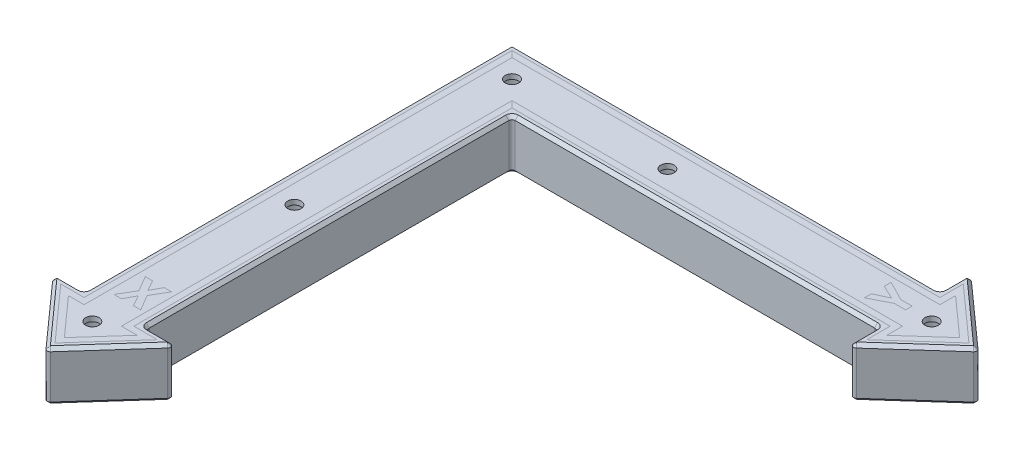
from build123d import *

# Parameters (mm, degrees)
BOSS_EXTRUDE1_DEPTH     = 16
CUT_EXTRUDE1_DEPTH      = 213.734576409
CUT_EXTRUDE1_DEPTH_BACK = 213.734576409
SKETCH2_R               = 2.15
SKETCH3_R               = 5
CUT_EXTRUDE2_DEPTH      = 14.4
CUT_EXTRUDE3_DEPTH      = 1
BOSS_EXTRUDE2_DEPTH     = 1
CUT_EXTRUDE4_DEPTH      = 1
BOSS_EXTRUDE3_DEPTH     = 1
FILLET1_R               = 1
CHAMFER1_SIZE           = 1
CUT_EXTRUDE5_DEPTH      = 1
BOSS_EXTRUDE4_DEPTH     = 1
CUT_EXTRUDE6_DEPTH      = 1
BOSS_EXTRUDE5_DEPTH     = 1
CHAMFER2_SIZE           = 1


with BuildPart() as part:
    # Sketch1 → Boss-Extrude1 (new body)
    with BuildSketch(Plane(origin=(0, 0, 0), x_dir=(1, 0, 0), z_dir=(0, 1, 0))):
        Polygon((0, -150), (20, -127.639320225), (10, -127.639320225), (10, -10), (127.639320225, -10), (127.639320225, -20), (150, 0), (127.639320225, 20), (127.639320225, 10), (-10, 10), (-10, -127.639320225), (-20, -127.639320225), align=None)
    extrude(amount=BOSS_EXTRUDE1_DEPTH)

    # Sketch2 → Cut-Extrude1 (cut, two sides: drawn at the far end of the back side and taken through both)
    with BuildSketch(Plane(origin=(0, 16, 0), x_dir=(1, 0, 0), z_dir=(0, 1, 0)).offset(-CUT_EXTRUDE1_DEPTH_BACK)):
        with Locations(Location((0, 0, 0), (0, 0, 270))):
            Circle(SKETCH2_R)
        with Locations(Location((50, 0, 0), (0, 0, 270))):
            Circle(SKETCH2_R)
        with Locations(Location((135, 0, 0), (0, 0, 270))):
            Circle(SKETCH2_R)
        with Locations(Location((0, -135, 0), (0, 0, 270))):
            Circle(SKETCH2_R)
        with Locations(Location((0, -70, 0), (0, 0, 270))):
            Circle(SKETCH2_R)
    extrude(amount=CUT_EXTRUDE1_DEPTH + CUT_EXTRUDE1_DEPTH_BACK, mode=Mode.SUBTRACT)

    # Sketch3 → Cut-Extrude2 (cut)
    with BuildSketch(Plane.XZ):
        with Locations(Location((135, 0, 0), (0, 0, 270))):
            Circle(SKETCH3_R)
        with Locations(Location((50, 0, 0), (0, 0, 270))):
            Circle(SKETCH3_R)
        with Locations(Location((0, 0, 0), (0, 0, 270))):
            Circle(SKETCH3_R)
        with Locations(Location((0, 70, 0), (0, 0, 270))):
            Circle(SKETCH3_R)
        with Locations(Location((0, 135, 0), (0, 0, 270))):
            Circle(SKETCH3_R)
    extrude(amount=-CUT_EXTRUDE2_DEPTH, mode=Mode.SUBTRACT)

    # Sketch4 → Cut-Extrude3 (cut)
    with BuildSketch(Plane(origin=(0, 16, 0), x_dir=(1, 0, 0), z_dir=(0, 1, 0))):
        Polygon((-6, 6), (-6, -131.639320225), (-11.05572809, -131.639320225), (0, -144), (11.05572809, -131.639320225), (6, -131.639320225), (6, -6), (8, -8), (8, -129.639320225), (15.527864045, -129.639320225), (0, -147), (-15.527864045, -129.639320225), (-8, -129.639320225), (-8, 8), align=None)
    extrude(amount=-CUT_EXTRUDE3_DEPTH, mode=Mode.SUBTRACT)

    # Sketch5 → Cut-Extrude4 (cut)
    with BuildSketch(Plane(origin=(0, 16, 0), x_dir=(1, 0, 0), z_dir=(0, 1, 0))):
        Polygon((131.639320225, 11.05572809), (131.639320225, 6), (-6, 6), (-8, 8), (129.639320225, 8), (129.639320225, 15.527864045), (147, 0), (129.639320225, -15.527864045), (129.639320225, -8), (8, -8), (6, -6), (131.639320225, -6), (131.639320225, -11.05572809), (144, 0), align=None)
    extrude(amount=-CUT_EXTRUDE4_DEPTH, mode=Mode.SUBTRACT)

    # Fillet1
    fillet1_edges = [part.edges().sort_by_distance(p)[0] for p in [
        (150, 8, 0),
        (127.639320225, 8, 20),
        (127.639320225, 8, 10),
        (10, 8, 10),
        (10, 8, 127.639320225),
        (20, 8, 127.639320225),
        (0, 8, 150),
        (-20, 8, 127.639320225),
        (-10, 8, 127.639320225),
        (-10, 8, -10),
        (127.639320225, 8, -10),
        (127.639320225, 8, -20),
    ]]
    fillet(fillet1_edges, radius=FILLET1_R)

    # Chamfer1
    chamfer1_edges = [part.edges().sort_by_distance(p)[0] for p in [
        (127.639320225, 0, 14.381966011),
        (127.639320225, 16, 14.381966011),
        (68.819660113, 0, 10),
        (68.819660113, 16, 10),
        (58.819660113, 0, -10),
        (58.819660113, 16, -10),
        (127.639320225, 0, -14.381966011),
        (127.639320225, 16, -14.381966011),
        (-14.381966011, 0, 127.639320225),
        (-14.381966011, 16, 127.639320225),
        (-10, 0, 58.819660113),
        (-10, 16, 58.819660113),
        (10, 0, 68.819660113),
        (10, 16, 68.819660113),
        (14.381966011, 0, 127.639320225),
        (14.381966011, 16, 127.639320225),
        (139.236326779, 0, -9.627322004),
        (139.236326779, 0, 9.627322004),
        (9.627322004, 0, 139.236326779),
        (-9.627322004, 0, 139.236326779),
        (18.676802952, 0, 128.231071935),
        (-18.676802952, 0, 128.231071935),
        (0, 0, 149.5),
        (128.231071935, 0, 18.676802952),
        (149.5, 0, 0),
        (128.231071935, 0, -18.676802952),
        (-9.707106781, 0, -9.707106781),
        (139.236326779, 16, -9.627322004),
        (-9.627322004, 16, 139.236326779),
        (9.627322004, 16, 139.236326779),
        (139.236326779, 16, 9.627322004),
        (18.676802952, 16, 128.231071935),
        (-18.676802952, 16, 128.231071935),
        (0, 16, 149.5),
        (128.231071935, 16, 18.676802952),
        (149.5, 16, 0),
        (128.231071935, 16, -18.676802952),
        (-9.707106781, 16, -9.707106781),
        (127.346427006, 0, 10.292893219),
        (127.346427006, 16, 10.292893219),
        (127.346427006, 0, -10.292893219),
        (127.346427006, 16, -10.292893219),
        (-10.292893219, 0, 127.346427006),
        (-10.292893219, 16, 127.346427006),
        (10.292893219, 0, 127.346427006),
        (10.292893219, 16, 127.346427006),
        (10.292893219, 0, 10.292893219),
        (10.292893219, 16, 10.292893219),
    ]]
    chamfer(chamfer1_edges, length=CHAMFER1_SIZE - 0.0001)  # a hair under: the kernel refuses the full size

    # Sketch6 → Cut-Extrude5 (cut)
    with BuildSketch(Plane(origin=(0, 16, 0), x_dir=(1, 0, 0), z_dir=(0, 1, 0))):
        Polygon((0.258198052, -117.447646104), (2.12913961, -114), (4.491152597, -114), (1.587337662, -118.959415584), (4.566233766, -124), (2.175811688, -124), (0.258198052, -120.497564935), (-1.659415584, -124), (-4.049837662, -124), (-1.070941558, -118.959415584), (-3.974756494, -114), (-1.610714286, -114), align=None)
    extrude(amount=-CUT_EXTRUDE5_DEPTH, mode=Mode.SUBTRACT)

    # Sketch7 → Cut-Extrude6 (cut)
    with BuildSketch(Plane(origin=(0, 16, 0), x_dir=(1, 0, 0), z_dir=(0, 1, 0))):
        Polygon((122.088079969, 0.081576582), (117.583209839, 2.157469439), (117.583209839, 4.403816842), (123.956992307, 1.128654504), (127.583209839, 1.128654504), (127.583209839, -0.959413678), (123.956992307, -0.959413678), (117.583209839, -4.232546794), (117.583209839, -1.98011173), align=None)
    extrude(amount=-CUT_EXTRUDE6_DEPTH, mode=Mode.SUBTRACT)

    # Chamfer2
    chamfer2_edges = [part.edges().sort_by_distance(p)[0] for p in [
        (135, 0, 5),
        (50, 0, 5),
        (0, 0, 5),
        (0, 0, 75),
        (0, 0, 140),
    ]]
    chamfer(chamfer2_edges, length=CHAMFER2_SIZE)


with BuildPart() as body_2:
    # Sketch4<3> → Boss-Extrude2 (new body)
    with BuildSketch(Plane(origin=(0, 16, 0), x_dir=(1, 0, 0), z_dir=(0, 1, 0))):
        Polygon((-6, 6), (-6, -131.639320225), (-11.05572809, -131.639320225), (0, -144), (11.05572809, -131.639320225), (6, -131.639320225), (6, -6), (8, -8), (8, -129.639320225), (15.527864045, -129.639320225), (0, -147), (-15.527864045, -129.639320225), (-8, -129.639320225), (-8, 8), align=None)
    extrude(amount=-BOSS_EXTRUDE2_DEPTH)


with BuildPart() as body_3:
    # Sketch5<2> → Boss-Extrude3 (new body)
    with BuildSketch(Plane(origin=(0, 16, 0), x_dir=(1, 0, 0), z_dir=(0, 1, 0))):
        Polygon((131.639320225, 11.05572809), (131.639320225, 6), (-6, 6), (-8, 8), (129.639320225, 8), (129.639320225, 15.527864045), (147, 0), (129.639320225, -15.527864045), (129.639320225, -8), (8, -8), (6, -6), (131.639320225, -6), (131.639320225, -11.05572809), (144, 0), align=None)
    extrude(amount=-BOSS_EXTRUDE3_DEPTH)


with BuildPart() as body_4:
    # Sketch6<2> → Boss-Extrude4 (new body)
    with BuildSketch(Plane(origin=(0, 16, 0), x_dir=(1, 0, 0), z_dir=(0, 1, 0))):
        Polygon((0.258198052, -117.447646104), (2.12913961, -114), (4.491152597, -114), (1.587337662, -118.959415584), (4.566233766, -124), (2.175811688, -124), (0.258198052, -120.497564935), (-1.659415584, -124), (-4.049837662, -124), (-1.070941558, -118.959415584), (-3.974756494, -114), (-1.610714286, -114), align=None)
    extrude(amount=-BOSS_EXTRUDE4_DEPTH)


with BuildPart() as body_5:
    # Sketch7<2> → Boss-Extrude5 (new body)
    with BuildSketch(Plane(origin=(0, 16, 0), x_dir=(1, 0, 0), z_dir=(0, 1, 0))):
        Polygon((122.088079969, 0.081576582), (117.583209839, 2.157469439), (117.583209839, 4.403816842), (123.956992307, 1.128654504), (127.583209839, 1.128654504), (127.583209839, -0.959413678), (123.956992307, -0.959413678), (117.583209839, -4.232546794), (117.583209839, -1.98011173), align=None)
    extrude(amount=-BOSS_EXTRUDE5_DEPTH)


solid = Compound([part.part, body_2.part, body_3.part, body_4.part, body_5.part])
